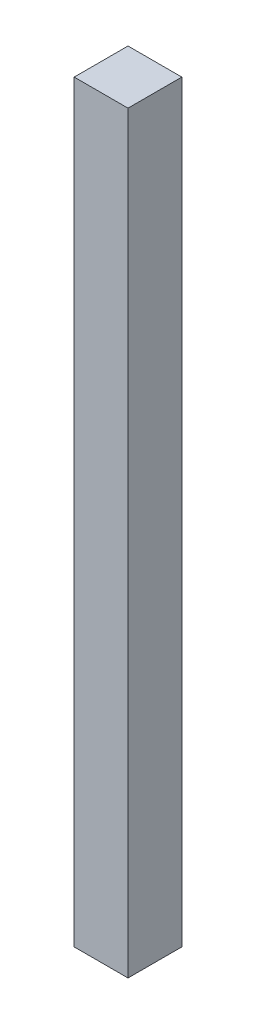
from build123d import *

# Parameters (mm, degrees)
SKETCH2_W           = 25
SKETCH2_H           = 25
BOSS_EXTRUDE1_DEPTH = 350


with BuildPart() as part:
    # Sketch2 → Boss-Extrude1 (new body)
    with BuildSketch(Plane(origin=(0, 0, 0), x_dir=(1, 0, 0), z_dir=(0, 1, 0))):
        with Locations((12.5, 12.5)):
            Rectangle(SKETCH2_W, SKETCH2_H)
    extrude(amount=BOSS_EXTRUDE1_DEPTH)


solid = part.part
